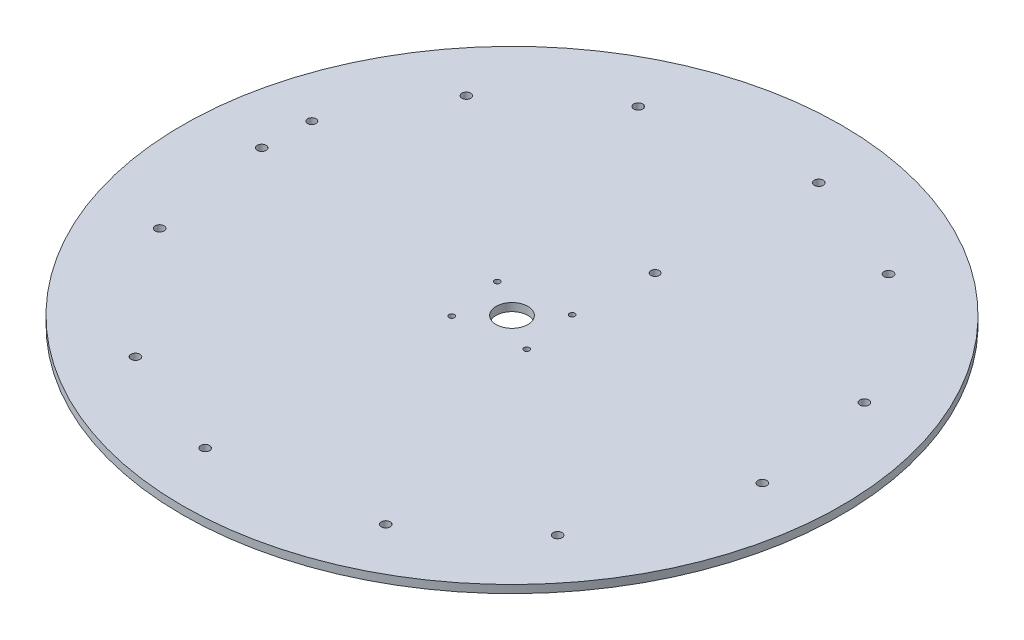
from build123d import *

# Parameters (mm, degrees)
SKETCH2_R               = 125
BOSS_EXTRUDE1_DEPTH     = 3
CUT_EXTRUDE1_START      = -26
SKETCH3_R               = 1.7
CUT_EXTRUDE1_DEPTH      = 88
CUT_EXTRUDE2_DEPTH      = 55
CUT_EXTRUDE2_DEPTH_BACK = 12
SKETCH4_R               = 6
SKETCH5_R               = 1.6
CUT_EXTRUDE3_DEPTH      = 177.802149308
CUT_EXTRUDE4_REACH      = 178.802
SKETCH6_R               = 1.05
CIRPATTERN1_COUNT       = 6


with BuildPart() as part:
    # Sketch2 → Boss-Extrude1 (new body)
    with BuildSketch(Plane(origin=(0, 0, 0), x_dir=(1, 0, 0), z_dir=(0, 1, 0))):
        Circle(SKETCH2_R)
    extrude(amount=BOSS_EXTRUDE1_DEPTH)

    # Sketch3 → Cut-Extrude1 (cut)
    with BuildSketch(Plane(origin=(0, 3, 0), x_dir=(1, 0, 0), z_dir=(0, 1, 0)).offset(CUT_EXTRUDE1_START)):
        with Locations((57.824361976, 84.994428132)):
            Circle(SKETCH3_R)
        with Locations((14.606066285, 101.75643704)):
            Circle(SKETCH3_R)
        with Locations((44.695152955, -92.574580495)):
            Circle(SKETCH3_R)
        with Locations((80.820626333, -63.527442972)):
            Circle(SKETCH3_R)
        with Locations((-102.519514931, 7.580152362)):
            Circle(SKETCH3_R)
        with Locations((-95.426692618, -38.228994068)):
            Circle(SKETCH3_R)
    cut_extrude1 = extrude(amount=CUT_EXTRUDE1_DEPTH, mode=Mode.SUBTRACT)

    # Sketch4 → Cut-Extrude2 (cut, two sides: drawn at the far end of the back side and taken through both)
    with BuildSketch(Plane(origin=(0, 3, 0), x_dir=(1, 0, 0), z_dir=(0, 1, 0)).offset(-CUT_EXTRUDE2_DEPTH_BACK)):
        Circle(SKETCH4_R)
    extrude(amount=CUT_EXTRUDE2_DEPTH + CUT_EXTRUDE2_DEPTH_BACK, mode=Mode.SUBTRACT)

    # Sketch5 → Cut-Extrude3 (cut, through all)
    with BuildSketch(Plane.XZ):
        with Locations((-101.778099897, -25.854755487)):
            Circle(SKETCH5_R)
        with Locations((13.216774043, -41.092175458)):
            Circle(SKETCH5_R)
    extrude(amount=-CUT_EXTRUDE3_DEPTH, mode=Mode.SUBTRACT)

    # Sketch6 → Cut-Extrude4 (cut, up to next)
    with BuildSketch(Plane(origin=(0, 3, 0), x_dir=(1, 0, 0), z_dir=(0, 1, 0)), mode=Mode.PRIVATE) as cut_extrude4_sk1:
        with Locations((11.198414604, 11.625148557)):
            Circle(SKETCH6_R)
    cut_extrude4_tool1 = extrude(cut_extrude4_sk1.sketch, amount=-CUT_EXTRUDE4_REACH, mode=Mode.PRIVATE) & part.part
    # Sketch6 → Cut-Extrude4 (cut, up to next)
    with BuildSketch(Plane(origin=(0, 3, 0), x_dir=(1, 0, 0), z_dir=(0, 1, 0)), mode=Mode.PRIVATE) as cut_extrude4_sk2:
        with Locations((13.889158795, -8.300914364)):
            Circle(SKETCH6_R)
    cut_extrude4_tool2 = extrude(cut_extrude4_sk2.sketch, amount=-CUT_EXTRUDE4_REACH, mode=Mode.PRIVATE) & part.part
    # Sketch6 → Cut-Extrude4 (cut, up to next)
    with BuildSketch(Plane(origin=(0, 3, 0), x_dir=(1, 0, 0), z_dir=(0, 1, 0)), mode=Mode.PRIVATE) as cut_extrude4_sk3:
        with Locations((-11.198414604, -11.625148557)):
            Circle(SKETCH6_R)
    cut_extrude4_tool3 = extrude(cut_extrude4_sk3.sketch, amount=-CUT_EXTRUDE4_REACH, mode=Mode.PRIVATE) & part.part
    # Sketch6 → Cut-Extrude4 (cut, up to next)
    with BuildSketch(Plane(origin=(0, 3, 0), x_dir=(1, 0, 0), z_dir=(0, 1, 0)), mode=Mode.PRIVATE) as cut_extrude4_sk4:
        with Locations((-13.889158795, 8.300914364)):
            Circle(SKETCH6_R)
    cut_extrude4_tool4 = extrude(cut_extrude4_sk4.sketch, amount=-CUT_EXTRUDE4_REACH, mode=Mode.PRIVATE) & part.part
    add(cut_extrude4_tool1.solids().sort_by_distance((11.198415, 3, -11.625149))[0], mode=Mode.SUBTRACT)
    add(cut_extrude4_tool2.solids().sort_by_distance((13.889159, 3, 8.300914))[0], mode=Mode.SUBTRACT)
    add(cut_extrude4_tool3.solids().sort_by_distance((-11.198415, 3, 11.625149))[0], mode=Mode.SUBTRACT)
    add(cut_extrude4_tool4.solids().sort_by_distance((-13.889159, 3, -8.300914))[0], mode=Mode.SUBTRACT)

    # CirPattern1: Cut-Extrude1 ×6 about axis
    cirpattern1_axis = Axis((0, 3, 0), (0, 1, 0))
    for i in range(1, CIRPATTERN1_COUNT):
        add(cut_extrude1.rotate(cirpattern1_axis, i * 360 / CIRPATTERN1_COUNT), mode=Mode.SUBTRACT)


solid = part.part
